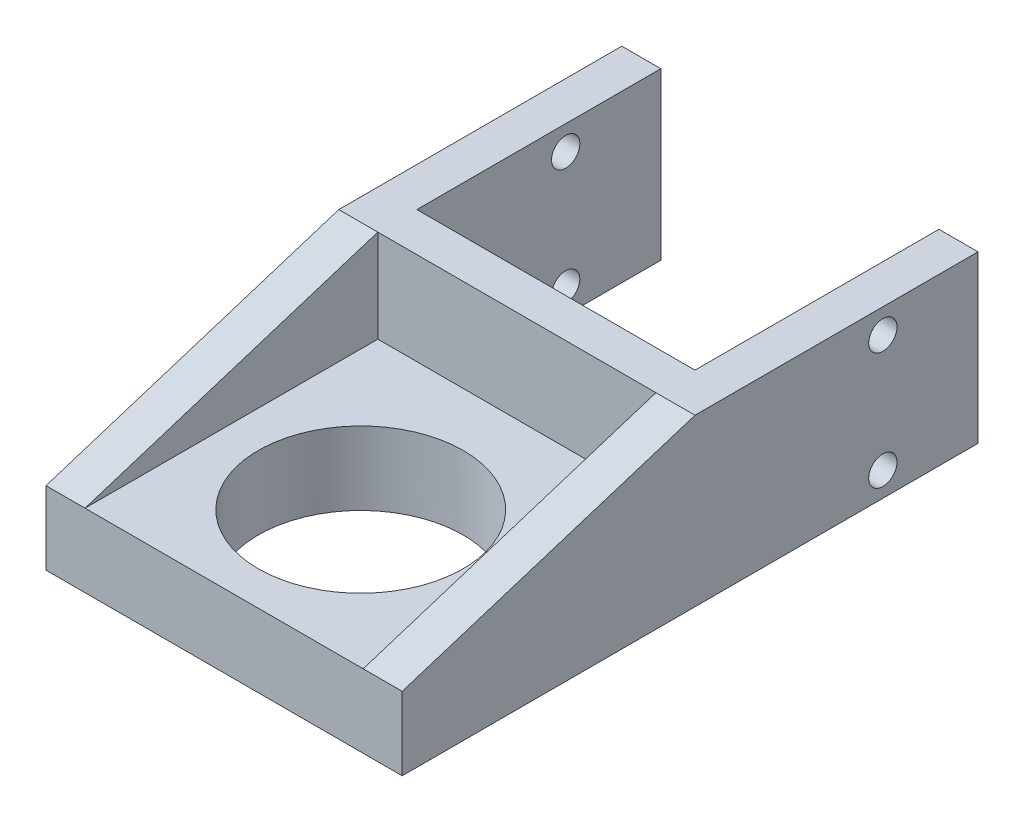
from build123d import *

# Parameters (mm, degrees)
BOSS_EXTRUDE1_DEPTH            = 17
M2_5_START                     = -4
M2_5_CLEARANCE_HOLE1_OUTLINE_R = 1.45
M2_5_CLEARANCE_HOLE1_DEPTH     = 36.5
SKETCH6_W                      = 36.5
SKETCH6_H                      = 17
BOSS_EXTRUDE2_DEPTH            = 30
SKETCH7_R                      = 10.5
CUT_EXTRUDE1_DEPTH             = 51.012498438
SKETCH8_W                      = 36.5
SKETCH8_H                      = 30
CUT_EXTRUDE2_DEPTH             = 9.5
RIB1_REACH                     = 54.7
SKETCH9_WALL_W                 = 138.86747894
SKETCH9_WALL_H                 = 4
RIB2_START                     = -4
RIB2_DEPTH                     = 4


# Read off the part's stored shape, not the designer's step: M2.5 Clearance Hole1, Rib2
with BuildPart() as part:
    # Sketch1 → Boss-Extrude1 (new body)
    with BuildSketch(Plane(origin=(0, 0, 0), x_dir=(1, 0, 0), z_dir=(0, 1, 0))):
        Polygon((32.5, -4), (32.5, 25), (28.5, 25), (28.5, 0), (0, 0), (0, 25), (-4, 25), (-4, -4), align=None)
    extrude(amount=BOSS_EXTRUDE1_DEPTH)

    # M2.5 Clearance Hole1 outline → M2.5 Clearance Hole1 (cut)
    with BuildSketch(Plane.YZ.offset(M2_5_START)):
        with Locations((2.5, -15.25)):
            Circle(M2_5_CLEARANCE_HOLE1_OUTLINE_R)
        with Locations((14.5, -15.25)):
            Circle(M2_5_CLEARANCE_HOLE1_OUTLINE_R)
    extrude(amount=M2_5_CLEARANCE_HOLE1_DEPTH, mode=Mode.SUBTRACT)

    # Sketch6 → Boss-Extrude2 (add)
    with BuildSketch(Plane.XY.offset(4)):
        with Locations((14.25, 8.5)):
            Rectangle(SKETCH6_W, SKETCH6_H)
    extrude(amount=BOSS_EXTRUDE2_DEPTH)

    # Sketch7 → Cut-Extrude1 (cut, through all)
    with BuildSketch(Plane(origin=(0, 17, 0), x_dir=(1, 0, 0), z_dir=(0, 1, 0))):
        with Locations(Location((14.25, -20, 0), (0, 0, 270))):
            Circle(SKETCH7_R)
    extrude(amount=-CUT_EXTRUDE1_DEPTH, mode=Mode.SUBTRACT)

    # Sketch8 → Cut-Extrude2 (cut)
    with BuildSketch(Plane(origin=(0, 17, 0), x_dir=(1, 0, 0), z_dir=(0, 1, 0))):
        with Locations((14.25, -19)):
            Rectangle(SKETCH8_W, SKETCH8_H)
    extrude(amount=-CUT_EXTRUDE2_DEPTH, mode=Mode.SUBTRACT)

    # Sketch9 wall → Rib1 (add, up to next)
    with BuildSketch(Plane(origin=(32.5, 12.25, 19), x_dir=(0, 0.301891704694, -0.953342225351), z_dir=(0, 0.953342225351, 0.301891704694)), mode=Mode.PRIVATE) as rib1_sk1:
        with Locations((0, 2)):
            Rectangle(SKETCH9_WALL_W, SKETCH9_WALL_H)
    rib1_tool1 = extrude(rib1_sk1.sketch, amount=-RIB1_REACH, mode=Mode.PRIVATE) - part.part
    add(rib1_tool1.solids().sort_by_distance((32.5, 12.25, 19))[0])

    # Rib2 outline → Rib2 (add)
    with BuildSketch(Plane.ZY.offset(4).offset(RIB2_START)):
        Polygon((34, 7.5), (4, 17), (4, 7.5), align=None)
    extrude(amount=RIB2_DEPTH)


solid = part.part
